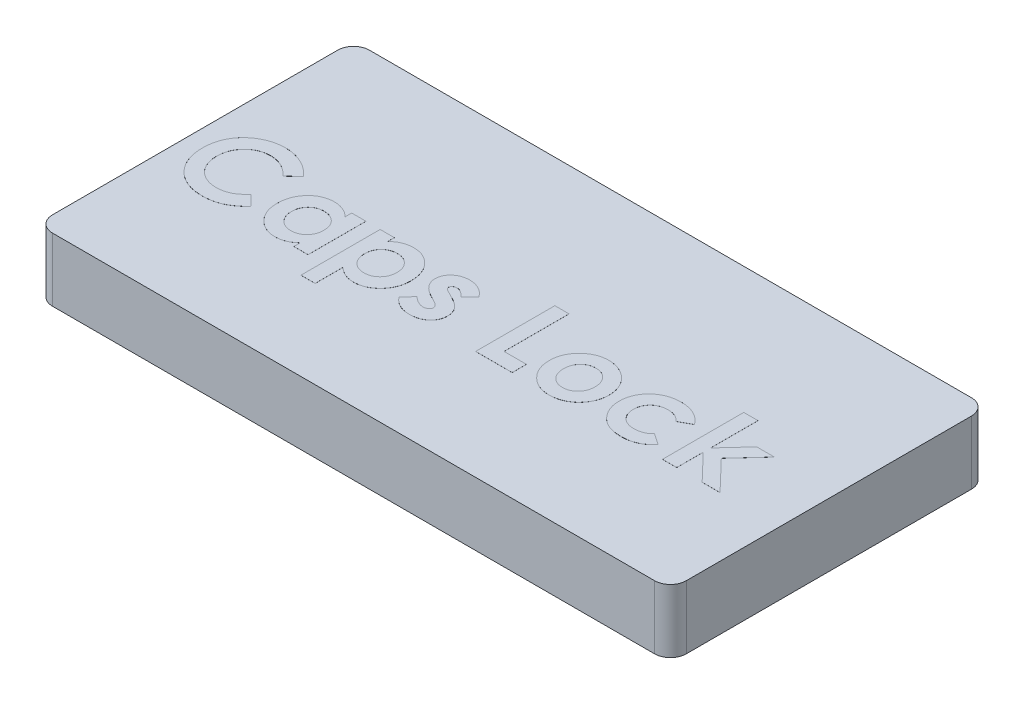
from build123d import *

# Parameters (mm, degrees)
SKETCH1_W           = 25.4
SKETCH1_H           = 12.7
BOSS_EXTRUDE1_DEPTH = 2.54
FILLET1_R           = 0.635
SHELL1_START        = 0.635
SHELL1_OUTLINE_W    = 1.905
SHELL1_OUTLINE_H    = 11.43
SHELL1_DEPTH        = 24.13
SKETCH2_R           = 2.54
BOSS_EXTRUDE2_DEPTH = 1.905
BOSS_EXTRUDE3_DEPTH = 0.00254


# Read off the part's stored shape, not the designer's step: Shell1
with BuildPart() as part:
    # Sketch1 → Boss-Extrude1 (new body)
    with BuildSketch(Plane(origin=(0, 0, 0), x_dir=(1, 0, 0), z_dir=(0, 1, 0))):
        with Locations((12.7, 6.35)):
            Rectangle(SKETCH1_W, SKETCH1_H)
    extrude(amount=BOSS_EXTRUDE1_DEPTH)

    # Fillet1
    fillet1_edges = [part.edges().sort_by_distance(p)[0] for p in [
        (0, 1.27, -12.7),
        (25.4, 1.27, -12.7),
        (25.4, 1.27, 0),
        (0, 1.27, 0),
    ]]
    fillet(fillet1_edges, radius=FILLET1_R)

    # Shell1 outline → Shell1 (cut)
    with BuildSketch(Plane.YZ.offset(SHELL1_START)):
        with Locations((0.9525, -6.35)):
            Rectangle(SHELL1_OUTLINE_W, SHELL1_OUTLINE_H)
    extrude(amount=SHELL1_DEPTH, mode=Mode.SUBTRACT)

    # Sketch2 → Boss-Extrude2 (add)
    with BuildSketch(Plane(origin=(0, 1.905, 0), x_dir=(-1, 0, 0), z_dir=(0, -1, 0))):
        with Locations(Location((-12.7, 6.35, 0), (0, 0, 270))):
            Circle(SKETCH2_R)
    extrude(amount=BOSS_EXTRUDE2_DEPTH)

    # Sketch3 → Boss-Extrude3 (add)
    # profile 1 of 8: a face of its own
    with BuildSketch(Plane(origin=(0, 2.54, 0), x_dir=(1, 0, 0), z_dir=(0, 1, 0))):
        with BuildLine():
            Line((3.698305128, 6.993008734), (3.280441546, 6.593589663))
            add(Edge.make_bspline(
                [(3.280441546, 6.593589663), (3.244994953, 6.6302415), (3.175756652, 6.70183402), (3.064187691, 6.796616208), (2.948160035, 6.875604336), (2.829930769, 6.942127635), (2.707373291, 6.992457252), (2.581904701, 7.029133291), (2.452723843, 7.051493286), (2.365299207, 7.054051666), (2.321326963, 7.055338462)],
                knots=[0, 0, 0, 0, 1.115251505, 2.178435587, 3.19620269, 4.182487026, 5.141301733, 6.088180966, 7.038406374, 8, 8, 8, 8], degree=3))
            add(Edge.make_bspline(
                [(2.321326963, 7.055338462), (2.284604796, 7.054321848), (2.212137645, 7.052315672), (2.105736877, 7.037608428), (2.003959044, 7.012598119), (1.906455743, 6.978129281), (1.813513883, 6.933528433), (1.7249386, 6.878830097), (1.640948271, 6.814528275), (1.562652361, 6.740955668), (1.491030014, 6.660572066), (1.42774711, 6.574802955), (1.374737527, 6.483844826), (1.331233425, 6.388618837), (1.29734541, 6.288684235), (1.273145111, 6.1841083), (1.259148304, 6.074766489), (1.257059187, 6.000436741), (1.255997436, 5.962660176)],
                knots=[0, 0, 0, 0, 1.035432265, 2.043311493, 3.022114605, 3.98653278, 4.95457646, 5.923598177, 6.917315552, 7.932509744, 8.948865224, 9.949768934, 10.933144597, 11.912367597, 12.897413939, 13.903909035, 14.934704909, 16, 16, 16, 16], degree=3))
            add(Edge.make_bspline(
                [(1.255997436, 5.962660176), (1.25630342, 5.93614594), (1.256906522, 5.883885836), (1.263508537, 5.806578637), (1.274139337, 5.731572378), (1.289524739, 5.658980674), (1.308764335, 5.588740615), (1.331336762, 5.520246244), (1.359653539, 5.454443999), (1.39108559, 5.390569629), (1.427640702, 5.330366028), (1.467053857, 5.272956898), (1.509790988, 5.218623652), (1.556128908, 5.167588408), (1.606719763, 5.120648731), (1.660255968, 5.076393089), (1.717640605, 5.035929351), (1.777681648, 4.998242035), (1.840897778, 4.965502743), (1.905573793, 4.93584727), (1.972690313, 4.911762616), (2.041430153, 4.892348188), (2.111547662, 4.875839117), (2.183728654, 4.865673974), (2.25734741, 4.857976031), (2.307101332, 4.857500728), (2.332139263, 4.857261538)],
                knots=[0, 0, 0, 0, 1.103660481, 2.175337485, 3.227646561, 4.255952547, 5.262355991, 6.258840057, 7.255597736, 8.242457506, 9.22035537, 10.185017736, 11.140346927, 12.096287581, 13.051739095, 14.01125915, 14.986044842, 15.97314143, 16.960198552, 17.947847494, 18.933482797, 19.925264591, 20.920966487, 21.929612487, 22.958107872, 24, 24, 24, 24], degree=3))
            add(Edge.make_bspline(
                [(2.332139263, 4.857261538), (2.374607897, 4.858489957), (2.458047719, 4.860903479), (2.580507656, 4.879776883), (2.697199775, 4.910822564), (2.79043622, 4.94748571), (2.863484512, 4.983691042), (2.919095097, 5.017179191), (2.976600776, 5.054639363), (3.035046429, 5.097485345), (3.095089454, 5.145202968), (3.155669952, 5.198837337), (3.218338796, 5.256622348), (3.259392535, 5.297864647), (3.280441546, 5.319010337)],
                knots=[0, 0, 0, 0, 1.404581149, 2.759636711, 4.088442092, 5.392261763, 6.066678138, 6.783632037, 7.538459478, 8.336747902, 9.180226004, 10.074962426, 11.012997595, 12, 12, 12, 12], degree=3))
            Line((3.280441546, 5.319010337), (3.685584776, 4.893514543))
            add(Edge.make_bspline(
                [(3.685584776, 4.893514543), (3.657105387, 4.866018588), (3.601519712, 4.812352363), (3.517670264, 4.736151332), (3.433926343, 4.667676235), (3.352311029, 4.604441725), (3.271487378, 4.548289979), (3.19146396, 4.499164915), (3.113146676, 4.45582409), (3.034909243, 4.418998427), (2.956264826, 4.387729614), (2.875348963, 4.360809219), (2.791914287, 4.338035533), (2.705451216, 4.319660159), (2.616766225, 4.30492559), (2.525029341, 4.294979841), (2.430822221, 4.288293645), (2.366920072, 4.287692834), (2.334683333, 4.287389744)],
                knots=[0, 0, 0, 0, 1.244526981, 2.429050516, 3.560637417, 4.644440555, 5.67424972, 6.652764056, 7.595344123, 8.486817594, 9.369275933, 10.254498637, 11.166417451, 12.086725134, 13.032340136, 13.991389299, 14.986715468, 16, 16, 16, 16], degree=3))
            add(Edge.make_bspline(
                [(2.334683333, 4.287389744), (2.275468437, 4.288899249), (2.159601344, 4.291852933), (1.98980114, 4.313737726), (1.828495505, 4.350427196), (1.675292012, 4.402316227), (1.530239375, 4.468602032), (1.393374704, 4.549865316), (1.264918595, 4.645890176), (1.145908719, 4.755551107), (1.038258622, 4.876662399), (0.943108403, 5.006702701), (0.864400139, 5.146311114), (0.799046971, 5.293425175), (0.747941653, 5.448716222), (0.711972173, 5.612352234), (0.689790057, 5.78417521), (0.687363302, 5.901534263), (0.686125641, 5.961388141)],
                knots=[0, 0, 0, 0, 1.078019885, 2.10938526, 3.111377082, 4.085535484, 5.04941344, 6.010039228, 6.978205633, 7.964457913, 8.951525778, 9.924444315, 10.892603023, 11.863865945, 12.85144698, 13.863884204, 14.910567087, 16, 16, 16, 16], degree=3))
            add(Edge.make_bspline(
                [(0.686125641, 5.961388141), (0.686648616, 6.00042433), (0.687685026, 6.077784515), (0.698577786, 6.191742336), (0.713762928, 6.302830827), (0.737852774, 6.409896523), (0.766890707, 6.514381794), (0.803003193, 6.615151009), (0.846132553, 6.712493788), (0.894888628, 6.806573089), (0.950045888, 6.896772592), (1.011662603, 6.98231734), (1.078152517, 7.063867724), (1.151113276, 7.140341827), (1.229484664, 7.212411105), (1.313620519, 7.279685002), (1.403014805, 7.343128301), (1.49790948, 7.401104953), (1.596460994, 7.453547916), (1.697426351, 7.49980485), (1.800557492, 7.538464994), (1.905418369, 7.570532158), (2.012452019, 7.594468028), (2.120894461, 7.61258671), (2.231668412, 7.622715169), (2.306043523, 7.624373262), (2.34358758, 7.625210256)],
                knots=[0, 0, 0, 0, 1.071919942, 2.124283339, 3.142214191, 4.149696895, 5.136002878, 6.119640489, 7.086990633, 8.058538607, 9.028339693, 9.988281803, 10.952401235, 11.916291999, 12.888973767, 13.874849856, 14.873389453, 15.898127285, 16.927174885, 17.938320013, 18.946391617, 19.950418109, 20.947802303, 21.956882652, 22.968648068, 24, 24, 24, 24], degree=3))
            add(Edge.make_bspline(
                [(2.34358758, 7.625210256), (2.37561651, 7.62473047), (2.439341359, 7.623775887), (2.534238353, 7.615818393), (2.628376405, 7.603321229), (2.721418472, 7.584465671), (2.814030086, 7.56208174), (2.904994226, 7.53277307), (2.995745903, 7.500103034), (3.084861809, 7.461052678), (3.172466337, 7.418425686), (3.256507215, 7.370063816), (3.33839548, 7.318943202), (3.416316537, 7.262038304), (3.491730016, 7.201413168), (3.564241572, 7.136784943), (3.633214876, 7.067076087), (3.676498691, 7.017822665), (3.698305128, 6.993008734)],
                knots=[0, 0, 0, 0, 0.996412454, 1.982464992, 2.961075852, 3.949442424, 4.934965278, 5.923860011, 6.921385422, 7.934793307, 8.949617135, 9.951082467, 10.950285876, 11.951772932, 12.951063433, 13.960125323, 14.972308753, 16, 16, 16, 16], degree=3))
        make_face()
    # profile 2 of 8: a face of its own
    with BuildSketch(Plane(origin=(0, 2.54, 0), x_dir=(1, 0, 0), z_dir=(0, 1, 0))):
        with BuildLine():
            Line((5.937087179, 6.688992308), (6.506958974, 6.688992308))
            Line((6.506958974, 6.688992308), (6.506958974, 4.3688))
            Line((6.506958974, 4.3688), (5.937087179, 4.3688))
            Line((5.937087179, 4.3688), (5.937087179, 4.621935016))
            add(Edge.make_bspline(
                [(5.937087179, 4.621935016), (5.908850242, 4.597295124), (5.854047923, 4.549473959), (5.7676972, 4.487424782), (5.681094151, 4.43624223), (5.593822645, 4.395478118), (5.504541356, 4.365378018), (5.412607494, 4.343584842), (5.316697114, 4.330732873), (5.251498559, 4.328983365), (5.21838726, 4.328094872)],
                knots=[0, 0, 0, 0, 1.129196829, 2.191548051, 3.199897424, 4.157751732, 5.089409408, 6.034969131, 7.002052659, 8, 8, 8, 8], degree=3))
            add(Edge.make_bspline(
                [(5.21838726, 4.328094872), (5.181218355, 4.328931056), (5.107770492, 4.330583403), (4.999993907, 4.347977023), (4.895924899, 4.374601836), (4.795647944, 4.412279273), (4.699345487, 4.461101846), (4.60628052, 4.519795704), (4.518048462, 4.590421354), (4.433914811, 4.669923004), (4.356882545, 4.757375384), (4.289540211, 4.851564668), (4.232775628, 4.951154988), (4.186271443, 5.055816157), (4.149689896, 5.165471359), (4.123612487, 5.280468388), (4.108226786, 5.400848314), (4.10632247, 5.482846405), (4.10535641, 5.52444403)],
                knots=[0, 0, 0, 0, 0.980476535, 1.937477201, 2.874147792, 3.812856188, 4.758993464, 5.720109578, 6.712210464, 7.737600662, 8.772720504, 9.783789959, 10.789002326, 11.793715968, 12.802552247, 13.835794126, 14.902098527, 16, 16, 16, 16], degree=3))
            add(Edge.make_bspline(
                [(4.10535641, 5.52444403), (4.106370293, 5.567518426), (4.108359138, 5.652013653), (4.122907417, 5.776006381), (4.148503599, 5.893854751), (4.183405834, 6.005722001), (4.228301498, 6.111627458), (4.282981417, 6.211744627), (4.34818946, 6.305811819), (4.42333017, 6.392227944), (4.504463681, 6.471432497), (4.591262195, 6.540386342), (4.682368373, 6.598965841), (4.777879031, 6.646789445), (4.877780529, 6.683745106), (4.981678458, 6.710762712), (5.090034052, 6.726974224), (5.163846761, 6.72878216), (5.201214784, 6.729697436)],
                knots=[0, 0, 0, 0, 1.136281865, 2.228943489, 3.287578264, 4.313574083, 5.316051562, 6.317280042, 7.318008486, 8.329309503, 9.333984563, 10.305318864, 11.248632312, 12.186624717, 13.117503092, 14.05354244, 15.014596925, 16, 16, 16, 16], degree=3))
            add(Edge.make_bspline(
                [(5.201214784, 6.729697436), (5.235829681, 6.728978304), (5.304320085, 6.727555402), (5.40499111, 6.712105404), (5.502627486, 6.688738379), (5.596696599, 6.655444575), (5.687970037, 6.613404374), (5.774877838, 6.560724869), (5.85932119, 6.499620156), (5.910844911, 6.45189608), (5.937087179, 6.427589063)],
                knots=[0, 0, 0, 0, 1.017011718, 2.012299608, 2.98747302, 3.965332399, 4.941441765, 5.936729654, 6.94912688, 8, 8, 8, 8], degree=3))
            Line((5.937087179, 6.427589063), (5.937087179, 6.688992308))
        make_face()
        with BuildLine():
            add(Edge.make_bspline(
                [(5.320786098, 6.200530769), (5.298078387, 6.199834018), (5.253572755, 6.198468432), (5.188121134, 6.190254334), (5.125569019, 6.175780729), (5.066362526, 6.154399085), (5.009619262, 6.128353127), (4.956200882, 6.095730993), (4.905666508, 6.057172324), (4.858313337, 6.013610625), (4.815143945, 5.965728353), (4.77792941, 5.91347842), (4.746303067, 5.858268665), (4.719555401, 5.79993309), (4.70041014, 5.737781407), (4.685247101, 5.672622718), (4.677378466, 5.603924712), (4.67595213, 5.557109147), (4.675228205, 5.533348277)],
                knots=[0, 0, 0, 0, 1.04836806, 2.054732945, 3.03993516, 4.00574415, 4.955904794, 5.917688631, 6.888591924, 7.88601754, 8.884115178, 9.859153345, 10.841239365, 11.818093293, 12.814750328, 13.83810466, 14.90274714, 16, 16, 16, 16], degree=3))
            add(Edge.make_bspline(
                [(4.675228205, 5.533348277), (4.675941072, 5.509371883), (4.677345769, 5.462126676), (4.68537433, 5.392849178), (4.699991739, 5.326738674), (4.721317989, 5.264329623), (4.747362287, 5.204779922), (4.779064054, 5.148364396), (4.818004123, 5.096080544), (4.861211357, 5.046691154), (4.909535971, 5.002588346), (4.960356289, 4.963429101), (5.014366478, 4.930664586), (5.070980564, 4.904184097), (5.130007982, 4.882604725), (5.192188758, 4.868313023), (5.256913752, 4.859176608), (5.301038489, 4.857904303), (5.323330168, 4.857261538)],
                knots=[0, 0, 0, 0, 1.099136573, 2.165835871, 3.191374663, 4.196217796, 5.183857741, 6.167377911, 7.154730987, 8.166690795, 9.170734848, 10.148332609, 11.103258353, 12.059567475, 13.009337315, 13.978056681, 14.978520572, 16, 16, 16, 16], degree=3))
            add(Edge.make_bspline(
                [(5.323330168, 4.857261538), (5.346460837, 4.857962196), (5.391809522, 4.859335864), (5.458328954, 4.867474999), (5.521721368, 4.882001674), (5.581723019, 4.903505733), (5.639250375, 4.929364732), (5.693784304, 4.961349405), (5.744733029, 4.999819592), (5.792354582, 5.04377509), (5.835990556, 5.092048349), (5.873719739, 5.144983457), (5.906583238, 5.200887404), (5.932428868, 5.261081961), (5.952953922, 5.324514007), (5.967680175, 5.391577213), (5.975690403, 5.462343882), (5.977082814, 5.510644891), (5.977792308, 5.53525633)],
                knots=[0, 0, 0, 0, 1.050008698, 2.058587853, 3.036635738, 3.995319155, 4.947022481, 5.895997462, 6.858296291, 7.838991643, 8.833936038, 9.806048392, 10.784806122, 11.771666913, 12.772873988, 13.80724452, 14.882696879, 16, 16, 16, 16], degree=3))
            add(Edge.make_bspline(
                [(5.977792308, 5.53525633), (5.977091631, 5.559444464), (5.975723005, 5.606690916), (5.967645629, 5.675980011), (5.952814828, 5.741726402), (5.932712213, 5.80405094), (5.906406782, 5.862811121), (5.873518418, 5.917355434), (5.836203102, 5.969573636), (5.792084015, 6.016542768), (5.744720438, 6.060179994), (5.693022429, 6.097486815), (5.638618757, 6.129638869), (5.581175164, 6.156036944), (5.520159748, 6.175387735), (5.456659, 6.190370343), (5.389682177, 6.198463502), (5.344126226, 6.199830435), (5.320786098, 6.200530769)],
                knots=[0, 0, 0, 0, 1.106611376, 2.161533483, 3.185006901, 4.184773755, 5.152708835, 6.122342771, 7.094156588, 8.082475533, 9.064254463, 10.03606828, 10.992420271, 11.951521816, 12.920622147, 13.915721683, 14.932141191, 16, 16, 16, 16], degree=3))
        make_face(mode=Mode.SUBTRACT)
    # profile 3 of 8: a face of its own
    with BuildSketch(Plane(origin=(0, 2.54, 0), x_dir=(1, 0, 0), z_dir=(0, 1, 0))):
        with BuildLine():
            Line((7.646702564, 6.688992308), (7.646702564, 6.427589063))
            add(Edge.make_bspline(
                [(7.646702564, 6.427589063), (7.673159208, 6.451896948), (7.725117325, 6.499635127), (7.81018682, 6.560754246), (7.897608567, 6.613246085), (7.988988849, 6.65546635), (8.083073592, 6.688732576), (8.180705852, 6.712106942), (8.281167831, 6.727522964), (8.349444804, 6.728968889), (8.383846995, 6.729697436)],
                knots=[0, 0, 0, 0, 1.054376801, 2.070687235, 3.070225973, 4.045259405, 5.022040922, 5.996139433, 6.99033025, 8, 8, 8, 8], degree=3))
            add(Edge.make_bspline(
                [(8.383846995, 6.729697436), (8.421218566, 6.728802293), (8.494828434, 6.727039151), (8.603131349, 6.710577688), (8.706920138, 6.683968866), (8.806590574, 6.646815699), (8.901611624, 6.598578516), (8.993050918, 6.540823597), (9.079331477, 6.471167658), (9.160495246, 6.392270627), (9.235573753, 6.305793621), (9.300878229, 6.211774761), (9.355274322, 6.111451517), (9.401377684, 6.006009919), (9.435025769, 5.893701252), (9.460958905, 5.776032063), (9.475410304, 5.652006845), (9.477412595, 5.567516127), (9.478433333, 5.52444403)],
                knots=[0, 0, 0, 0, 0.985987466, 1.942075377, 2.884088208, 3.810275091, 4.743821533, 5.692411115, 6.659945104, 7.665215984, 8.677116751, 9.678438675, 10.680260931, 11.685531812, 12.710472044, 13.769734641, 14.863044265, 16, 16, 16, 16], degree=3))
            add(Edge.make_bspline(
                [(9.478433333, 5.52444403), (9.477467273, 5.482846406), (9.475562955, 5.400848317), (9.460177266, 5.280468375), (9.434099813, 5.165471405), (9.39751843, 5.055815991), (9.351013636, 4.951155604), (9.294251326, 4.851562361), (9.226900393, 4.757384137), (9.149900895, 4.66988961), (9.065767755, 4.590656812), (8.978107053, 4.519569238), (8.885172877, 4.461318547), (8.789288373, 4.412121375), (8.688942997, 4.37450125), (8.584822153, 4.348144124), (8.477090741, 4.33052275), (8.403846503, 4.328912225), (8.366674519, 4.328094872)],
                knots=[0, 0, 0, 0, 1.098553145, 2.165490463, 3.199345634, 4.208780719, 5.21409072, 6.219899742, 7.23156933, 8.267303578, 9.293302409, 10.281606823, 11.243293419, 12.184993323, 13.124258899, 14.066907486, 15.018941492, 16, 16, 16, 16], degree=3))
            add(Edge.make_bspline(
                [(8.366674519, 4.328094872), (8.33354998, 4.328898208), (8.268296631, 4.330480731), (8.1723431, 4.344590932), (8.079650899, 4.365666778), (7.990097415, 4.397388275), (7.902675908, 4.439482434), (7.81589748, 4.491903099), (7.729561467, 4.555943865), (7.674914784, 4.605338498), (7.646702564, 4.630839263)],
                knots=[0, 0, 0, 0, 0.990856396, 1.951927477, 2.896945079, 3.83213376, 4.788585491, 5.796263726, 6.862286081, 8, 8, 8, 8], degree=3))
            Line((7.646702564, 4.630839263), (7.646702564, 3.513992308))
            Line((7.646702564, 3.513992308), (7.076830769, 3.513992308))
            Line((7.076830769, 3.513992308), (7.076830769, 6.688992308))
            Line((7.076830769, 6.688992308), (7.646702564, 6.688992308))
        make_face()
        with BuildLine():
            add(Edge.make_bspline(
                [(8.260459575, 6.200530769), (8.237332478, 6.199819595), (8.191990794, 6.198425307), (8.125420945, 6.190434649), (8.06234484, 6.175400168), (8.001803459, 6.15591394), (7.944563431, 6.129610594), (7.890156466, 6.097725531), (7.839048565, 6.059705027), (7.790974481, 6.017054648), (7.747776094, 5.969072891), (7.709398074, 5.917801896), (7.677558394, 5.862574016), (7.651016551, 5.804089535), (7.63099189, 5.741715658), (7.616139393, 5.675982999), (7.608068003, 5.606690117), (7.606698541, 5.559444193), (7.605997436, 5.53525633)],
                knots=[0, 0, 0, 0, 1.060469436, 2.079096586, 3.066888298, 4.028858836, 4.99004353, 5.948472697, 6.914558426, 7.905691313, 8.889602648, 9.869280844, 10.836099585, 11.806137001, 12.808075328, 13.83377171, 14.890985086, 16, 16, 16, 16], degree=3))
            add(Edge.make_bspline(
                [(7.605997436, 5.53525633), (7.606707363, 5.510645159), (7.608100625, 5.462344677), (7.61610473, 5.391574218), (7.630852978, 5.32452463), (7.651299396, 5.261043895), (7.677389594, 5.201123778), (7.70919155, 5.144542145), (7.747992012, 5.092539519), (7.790715849, 5.04329269), (7.839087187, 5.00007164), (7.889964846, 4.961308303), (7.944550213, 4.929375712), (8.002063793, 4.903502765), (8.06206918, 4.882002488), (8.125460566, 4.867474773), (8.191980281, 4.859335924), (8.237328927, 4.857962216), (8.260459575, 4.857261538)],
                knots=[0, 0, 0, 0, 1.117193555, 2.192540452, 3.22680955, 4.227918444, 5.21468246, 6.188555072, 7.166222992, 8.154674427, 9.142376254, 10.104580718, 11.053462639, 12.005072638, 12.963662044, 13.941614018, 14.950094269, 16, 16, 16, 16], degree=3))
            add(Edge.make_bspline(
                [(8.260459575, 4.857261538), (8.282748854, 4.857912446), (8.32686884, 4.859200871), (8.391423854, 4.868191043), (8.453477305, 4.882881878), (8.512543233, 4.903821632), (8.568981196, 4.93108517), (8.623304987, 4.962988023), (8.673639147, 5.002848256), (8.721958367, 5.046658054), (8.76519116, 5.096062907), (8.803976172, 5.148549056), (8.836556734, 5.204584951), (8.862424932, 5.264356415), (8.88381091, 5.326731289), (8.898411791, 5.392851251), (8.906444928, 5.462126131), (8.907848992, 5.509371699), (8.908561538, 5.533348277)],
                knots=[0, 0, 0, 0, 1.021711385, 2.02240246, 2.981887075, 3.941027022, 4.888772411, 5.852236371, 6.822344989, 7.82661704, 8.838806642, 9.826383926, 10.814965113, 11.80282933, 12.807900643, 13.833672313, 14.900613836, 16, 16, 16, 16], degree=3))
            add(Edge.make_bspline(
                [(8.908561538, 5.533348277), (8.907837613, 5.557109147), (8.906411278, 5.603924712), (8.898542642, 5.672622718), (8.883379605, 5.737781408), (8.86423434, 5.799933083), (8.837486689, 5.858268689), (8.805860288, 5.913478327), (8.768645968, 5.965728699), (8.725475754, 6.0136093), (8.678125638, 6.057177207), (8.627580195, 6.09571338), (8.574037923, 6.128518643), (8.516769692, 6.154389308), (8.457126943, 6.175675291), (8.39419821, 6.190337357), (8.328303416, 6.198452165), (8.283377923, 6.199828595), (8.260459575, 6.200530769)],
                knots=[0, 0, 0, 0, 1.094680664, 2.156827393, 3.177782763, 4.17210342, 5.146667393, 6.126451192, 7.099203661, 8.094961544, 9.09004898, 10.058676268, 11.018205477, 11.974998356, 12.947750825, 13.930643515, 14.944335875, 16, 16, 16, 16], degree=3))
        make_face(mode=Mode.SUBTRACT)
    # profile 4 of 8: a face of its own
    with BuildSketch(Plane(origin=(0, 2.54, 0), x_dir=(1, 0, 0), z_dir=(0, 1, 0))):
        with BuildLine():
            Line((11.391574359, 6.330914383), (11.043036699, 5.9563))
            add(Edge.make_bspline(
                [(11.043036699, 5.9563), (11.025632544, 5.975558641), (10.992344988, 6.012393127), (10.941384957, 6.062606763), (10.89118382, 6.104419888), (10.842677072, 6.139544656), (10.794874031, 6.166481155), (10.748172049, 6.185861362), (10.702548717, 6.198164206), (10.672307644, 6.199756762), (10.657610016, 6.200530769)],
                knots=[0, 0, 0, 0, 1.327646587, 2.539285, 3.655602211, 4.666613517, 5.598770349, 6.454635452, 7.248928967, 8, 8, 8, 8], degree=3))
            add(Edge.make_bspline(
                [(10.657610016, 6.200530769), (10.642737492, 6.200077506), (10.614261236, 6.199209647), (10.574074858, 6.191765596), (10.538768436, 6.178878571), (10.50889295, 6.161312355), (10.484890455, 6.139672582), (10.46808519, 6.114917191), (10.456800299, 6.087816135), (10.455845671, 6.068565207), (10.45535641, 6.058698838)],
                knots=[0, 0, 0, 0, 1.295068245, 2.479652818, 3.543291146, 4.55379989, 5.481948265, 6.332409746, 7.145336708, 8, 8, 8, 8], degree=3))
            add(Edge.make_bspline(
                [(10.45535641, 6.058698838), (10.45701407, 6.043747025), (10.460453521, 6.012723748), (10.484077778, 5.976741376), (10.515334377, 5.950197917), (10.551364198, 5.925497704), (10.600157903, 5.897880222), (10.637174047, 5.878969724), (10.657610016, 5.868529567)],
                knots=[0, 0, 0, 0, 0.916701701, 1.902049539, 2.5493345, 3.440293453, 4.586830489, 6, 6, 6, 6], degree=3))
            Line((10.657610016, 5.868529567), (10.863679728, 5.764222676))
            add(Edge.make_bspline(
                [(10.863679728, 5.764222676), (10.889895735, 5.750911039), (10.940759714, 5.725083963), (11.012269703, 5.683408507), (11.07831747, 5.643013663), (11.137578114, 5.601614403), (11.190414349, 5.559929972), (11.236450883, 5.517548166), (11.276804332, 5.475812568), (11.321804093, 5.419856541), (11.366817359, 5.345327666), (11.404344442, 5.248406337), (11.428275007, 5.144624904), (11.430922649, 5.072793817), (11.432279487, 5.035982492)],
                knots=[0, 0, 0, 0, 1.076693506, 2.088987655, 3.030641824, 3.911722491, 4.735175175, 5.493635918, 6.202154166, 6.859459289, 8.120623445, 9.372284821, 10.653373066, 12, 12, 12, 12], degree=3))
            add(Edge.make_bspline(
                [(11.432279487, 5.035982492), (11.431461983, 5.011148007), (11.429861911, 4.962540329), (11.419746593, 4.890994462), (11.401576862, 4.822964935), (11.377665523, 4.757391305), (11.345457667, 4.695459341), (11.306355751, 4.63686882), (11.26097721, 4.58085048), (11.208122396, 4.529320598), (11.150220831, 4.481295312), (11.08585347, 4.440902598), (11.017866359, 4.405388119), (10.944463384, 4.377654473), (10.866674482, 4.355169854), (10.78383284, 4.339588577), (10.696219558, 4.32978288), (10.63622463, 4.328667095), (10.605456571, 4.328094872)],
                knots=[0, 0, 0, 0, 0.976600749, 1.911466839, 2.833459288, 3.740827163, 4.650527853, 5.570709661, 6.506801416, 7.479409329, 8.468875524, 9.458587492, 10.461481786, 11.480119772, 12.538142914, 13.641687514, 14.790552763, 16, 16, 16, 16], degree=3))
            add(Edge.make_bspline(
                [(10.605456571, 4.328094872), (10.564691534, 4.329393012), (10.484673355, 4.331941146), (10.367812599, 4.349691086), (10.25746502, 4.380416532), (10.153539835, 4.423458951), (10.055400514, 4.478306792), (9.964448599, 4.546360957), (9.879107354, 4.625848346), (9.829454931, 4.686811473), (9.804074359, 4.717973678)],
                knots=[0, 0, 0, 0, 1.056901255, 2.07460411, 3.05625841, 4.019970729, 4.984811261, 5.963335951, 6.958928997, 8, 8, 8, 8], degree=3))
            Line((9.804074359, 4.717973678), (10.149431931, 5.101492308))
            add(Edge.make_bspline(
                [(10.149431931, 5.101492308), (10.166258918, 5.083744163), (10.199665991, 5.048508292), (10.255976816, 5.002045032), (10.315557657, 4.959697189), (10.379071792, 4.924138818), (10.44259876, 4.895427034), (10.503547644, 4.873889179), (10.560769796, 4.860354091), (10.597974164, 4.858256934), (10.615632853, 4.857261538)],
                knots=[0, 0, 0, 0, 1.087861918, 2.159761696, 3.243809206, 4.338405912, 5.394481878, 6.343674753, 7.213841449, 8, 8, 8, 8], degree=3))
            add(Edge.make_bspline(
                [(10.615632853, 4.857261538), (10.633281983, 4.857772669), (10.667208482, 4.858755203), (10.715426823, 4.868975487), (10.75816496, 4.886157293), (10.794408491, 4.909980303), (10.824554891, 4.93732548), (10.845796321, 4.968403435), (10.85984228, 5.001357895), (10.861549401, 5.0243984), (10.862407692, 5.035982492)],
                knots=[0, 0, 0, 0, 1.255011871, 2.412479185, 3.488767498, 4.514443302, 5.48617286, 6.365347346, 7.178144445, 8, 8, 8, 8], degree=3))
            add(Edge.make_bspline(
                [(10.862407692, 5.035982492), (10.861641842, 5.046891353), (10.860069405, 5.069289349), (10.847620365, 5.102350392), (10.828075127, 5.13508613), (10.800966949, 5.167588859), (10.765935122, 5.199594859), (10.723105015, 5.230847771), (10.673464721, 5.263014977), (10.636797574, 5.282214491), (10.617540905, 5.292297596)],
                knots=[0, 0, 0, 0, 0.704666567, 1.446816302, 2.258757648, 3.165368109, 4.175243826, 5.322435858, 6.59381024, 8, 8, 8, 8], degree=3))
            Line((10.617540905, 5.292297596), (10.42864367, 5.38770024))
            add(Edge.make_bspline(
                [(10.42864367, 5.38770024), (10.385794236, 5.410677821), (10.303539389, 5.454786161), (10.192361584, 5.530422589), (10.098265623, 5.610939073), (10.021174824, 5.69590305), (9.959748723, 5.78507609), (9.916899897, 5.879593541), (9.889944071, 5.978559356), (9.886978499, 6.046233254), (9.885484615, 6.080323437)],
                knots=[0, 0, 0, 0, 1.255999728, 2.41104856, 3.467751088, 4.449286722, 5.368722015, 6.253902015, 7.120417131, 8, 8, 8, 8], degree=3))
            add(Edge.make_bspline(
                [(9.885484615, 6.080323437), (9.886002682, 6.102417491), (9.88701973, 6.145791706), (9.897846819, 6.209489748), (9.914204228, 6.27071976), (9.937286293, 6.329578979), (9.966854016, 6.386125811), (10.003079607, 6.440109305), (10.046405013, 6.491431319), (10.095443207, 6.539926533), (10.149852622, 6.584093212), (10.208078699, 6.623235217), (10.269949215, 6.656576928), (10.335971934, 6.683159311), (10.405307671, 6.704317234), (10.478414115, 6.71869888), (10.554979362, 6.727845658), (10.60733778, 6.729071431), (10.634077364, 6.729697436)],
                knots=[0, 0, 0, 0, 0.959035663, 1.882742823, 2.798841253, 3.708806893, 4.623422363, 5.566085165, 6.527241613, 7.536786942, 8.55815439, 9.567237405, 10.580975912, 11.605536372, 12.654523293, 13.725718749, 14.838518481, 16, 16, 16, 16], degree=3))
            add(Edge.make_bspline(
                [(10.634077364, 6.729697436), (10.671045011, 6.728480308), (10.744419271, 6.726064525), (10.852631873, 6.706515992), (10.957154022, 6.67365942), (11.057692693, 6.628388559), (11.152954646, 6.571495952), (11.240845024, 6.502409112), (11.321958638, 6.422829271), (11.368138686, 6.361856923), (11.391574359, 6.330914383)],
                knots=[0, 0, 0, 0, 0.996590028, 1.978055413, 2.954661574, 3.945146934, 4.945404762, 5.939399542, 6.954276554, 8, 8, 8, 8], degree=3))
        make_face()
    # profile 5 of 8: a face of its own
    with BuildSketch(Plane(origin=(0, 2.54, 0), x_dir=(1, 0, 0), z_dir=(0, 1, 0))):
        Polygon((13.223305128, 7.5438), (13.793176923, 7.5438), (13.793176923, 4.938671795), (14.688689744, 4.938671795), (14.688689744, 4.3688), (13.223305128, 4.3688), align=None)
    # profile 6 of 8: a face of its own
    with BuildSketch(Plane(origin=(0, 2.54, 0), x_dir=(1, 0, 0), z_dir=(0, 1, 0))):
        with BuildLine():
            add(Edge.make_bspline(
                [(16.201139663, 6.729697436), (16.228082102, 6.729217977), (16.281440338, 6.72826843), (16.360910765, 6.720364324), (16.438991865, 6.70746845), (16.516132439, 6.690770543), (16.591616165, 6.667374278), (16.665838944, 6.639314075), (16.739464423, 6.607097682), (16.810665233, 6.568748905), (16.879955746, 6.527156158), (16.945647276, 6.481275947), (17.0071943, 6.431468643), (17.06573934, 6.378889069), (17.118554104, 6.321248081), (17.169013738, 6.261323064), (17.21439203, 6.196967113), (17.256405792, 6.129748435), (17.293810342, 6.060055742), (17.326289315, 5.98837384), (17.354478009, 5.915693784), (17.376549192, 5.84113028), (17.394822097, 5.765666546), (17.406353599, 5.688377832), (17.414551698, 5.610058087), (17.415470964, 5.557326789), (17.415933333, 5.530804207)],
                knots=[0, 0, 0, 0, 1.022364134, 2.024744242, 3.027414945, 4.024939316, 5.017584196, 6.023349371, 7.035562955, 8.064994934, 9.090267829, 10.101425541, 11.102933353, 12.093946398, 13.084502048, 14.067315274, 15.065326281, 16.070028806, 17.074376865, 18.064572984, 19.055292013, 20.030201733, 21.013838017, 21.999348303, 22.993720005, 24, 24, 24, 24], degree=3))
            add(Edge.make_bspline(
                [(17.415933333, 5.530804207), (17.415445379, 5.504074416), (17.414475216, 5.450929534), (17.406650196, 5.371873095), (17.39370496, 5.294220928), (17.376942966, 5.217515572), (17.353634256, 5.142738544), (17.326400517, 5.068787602), (17.292970031, 4.996670725), (17.256010165, 4.925601186), (17.213726272, 4.857670345), (17.16838726, 4.792669703), (17.118138976, 4.732304533), (17.065747009, 4.674702744), (17.00872629, 4.62181217), (16.947986975, 4.572774009), (16.884054898, 4.526988747), (16.816470321, 4.485530594), (16.746098889, 4.449102794), (16.674127402, 4.416260159), (16.600135012, 4.38891632), (16.52427485, 4.366618172), (16.446500909, 4.349353275), (16.366984894, 4.337625025), (16.285898053, 4.329468162), (16.231264933, 4.328555582), (16.203683734, 4.328094872)],
                knots=[0, 0, 0, 0, 1.012026251, 2.012137606, 3.004615893, 3.992048833, 4.982446996, 5.968083444, 6.973977695, 7.990229942, 8.999482246, 10.001782172, 10.988562221, 11.971415814, 12.948383116, 13.930088534, 14.925840678, 15.924049238, 16.929462851, 17.924729459, 18.917889337, 19.913673841, 20.916777188, 21.931792057, 22.95587778, 24, 24, 24, 24], degree=3))
            add(Edge.make_bspline(
                [(16.203683734, 4.328094872), (16.163354397, 4.329278617), (16.083864659, 4.331611798), (15.966795069, 4.347593474), (15.854329838, 4.375102129), (15.746285706, 4.413448588), (15.64252232, 4.462588146), (15.543945245, 4.523405811), (15.449573907, 4.594704257), (15.361042889, 4.675880864), (15.279936483, 4.764938954), (15.20908028, 4.860007921), (15.148917629, 4.959662843), (15.099502659, 5.064017359), (15.061364379, 5.173214568), (15.033822034, 5.286928009), (15.017820818, 5.405477312), (15.01550737, 5.486023129), (15.014330769, 5.526988101)],
                knots=[0, 0, 0, 0, 1.029999031, 2.030143771, 3.011211297, 3.982305373, 4.953580601, 5.938004764, 6.935448627, 7.970290061, 9.001484052, 10.007591832, 10.993831261, 11.969999897, 12.951306496, 13.942897864, 14.953773953, 16, 16, 16, 16], degree=3))
            add(Edge.make_bspline(
                [(15.014330769, 5.526988101), (15.015548402, 5.570729711), (15.017941635, 5.65670297), (15.036944958, 5.782655753), (15.067291214, 5.903249574), (15.110851354, 6.018147093), (15.166495602, 6.127560224), (15.234424617, 6.231258201), (15.31497411, 6.329264515), (15.376658892, 6.388542093), (15.408025681, 6.418684816)],
                knots=[0, 0, 0, 0, 1.043912699, 2.05178951, 3.033892, 4.007821512, 4.978932272, 5.95884105, 6.962068106, 8, 8, 8, 8], degree=3))
            add(Edge.make_bspline(
                [(15.408025681, 6.418684816), (15.436807846, 6.443669743), (15.493589098, 6.492959831), (15.585839945, 6.555476228), (15.680294402, 6.609471322), (15.778084548, 6.653865332), (15.879482995, 6.687337699), (15.983970134, 6.711702588), (16.091524239, 6.726668216), (16.164415505, 6.728682565), (16.201139663, 6.729697436)],
                knots=[0, 0, 0, 0, 1.048115528, 2.067714963, 3.060638214, 4.039924844, 5.017819947, 5.994373833, 6.98952318, 8, 8, 8, 8], degree=3))
        make_face()
        with BuildLine():
            add(Edge.make_bspline(
                [(16.213860016, 6.200530769), (16.191796144, 6.199797439), (16.148363174, 6.198353871), (16.084428702, 6.190606627), (16.023958805, 6.174727985), (15.965752438, 6.154534697), (15.910839277, 6.127529021), (15.857715447, 6.095926156), (15.809143271, 6.056379059), (15.762772184, 6.012998787), (15.720677573, 5.96482616), (15.684808968, 5.912342118), (15.652759575, 5.857554591), (15.628458145, 5.79845774), (15.608346388, 5.736666854), (15.594734993, 5.671183578), (15.585262412, 5.602739398), (15.584559207, 5.555854665), (15.584202564, 5.532076242)],
                knots=[0, 0, 0, 0, 1.030650113, 2.02884584, 2.99876339, 3.944280128, 4.900564847, 5.851248946, 6.823638398, 7.81794922, 8.81432732, 9.802856497, 10.78262424, 11.771747962, 12.779760563, 13.812642396, 14.89064281, 16, 16, 16, 16], degree=3))
            add(Edge.make_bspline(
                [(15.584202564, 5.532076242), (15.584619885, 5.507459272), (15.585435458, 5.459350131), (15.593880887, 5.389104316), (15.607807678, 5.322441502), (15.627593284, 5.259464671), (15.652477024, 5.199721782), (15.683006487, 5.143548032), (15.719503878, 5.091281174), (15.760883061, 5.042985569), (15.806191499, 4.999147114), (15.855836944, 4.961526592), (15.90774043, 4.928839352), (15.963098096, 4.902586453), (16.021123705, 4.882317085), (16.08198951, 4.867393431), (16.146015362, 4.85935329), (16.189670874, 4.857968377), (16.211951963, 4.857261538)],
                knots=[0, 0, 0, 0, 1.141730614, 2.231293227, 3.276944405, 4.297399982, 5.28939179, 6.275415646, 7.257752684, 8.24146775, 9.222424823, 10.176631434, 11.126518621, 12.063689483, 13.012557477, 13.974037417, 14.965980454, 16, 16, 16, 16], degree=3))
            add(Edge.make_bspline(
                [(16.211951963, 4.857261538), (16.234244196, 4.857888472), (16.277949914, 4.859117625), (16.342050952, 4.868322044), (16.403227583, 4.882807984), (16.461748776, 4.903251803), (16.517141381, 4.930066632), (16.569617447, 4.962910252), (16.619638612, 5.001054041), (16.665555094, 5.045719644), (16.708059103, 5.094165866), (16.745332577, 5.146708638), (16.776479697, 5.202882401), (16.802025913, 5.262333712), (16.821850305, 5.324980853), (16.835546536, 5.391056677), (16.845024181, 5.460356409), (16.845711482, 5.507874384), (16.846061538, 5.532076242)],
                knots=[0, 0, 0, 0, 1.031504075, 2.022346795, 2.991027682, 3.937587355, 4.885570121, 5.833146507, 6.798790848, 7.791235734, 8.792807298, 9.778388351, 10.766749885, 11.760164525, 12.768777521, 13.802286646, 14.880660483, 16, 16, 16, 16], degree=3))
            add(Edge.make_bspline(
                [(16.846061538, 5.532076242), (16.845638909, 5.556269642), (16.844809573, 5.60374494), (16.836363542, 5.673138399), (16.822573424, 5.739000647), (16.802532628, 5.801050458), (16.777796793, 5.859995721), (16.747246228, 5.915534719), (16.710568844, 5.967393906), (16.668988505, 6.015316136), (16.623000865, 6.058539438), (16.574217385, 6.097084131), (16.521522538, 6.128963553), (16.465904909, 6.155243576), (16.407216527, 6.175462303), (16.34552328, 6.190470533), (16.280636097, 6.198396267), (16.23635134, 6.199811832), (16.213860016, 6.200530769)],
                knots=[0, 0, 0, 0, 1.123894411, 2.205445421, 3.243160173, 4.246488011, 5.231014757, 6.210004299, 7.185865357, 8.177612767, 9.153374344, 10.115157457, 11.061423229, 12.009021698, 12.96873347, 13.94135618, 14.954456845, 16, 16, 16, 16], degree=3))
        make_face(mode=Mode.SUBTRACT)
    # profile 7 of 8: a face of its own
    with BuildSketch(Plane(origin=(0, 2.54, 0), x_dir=(1, 0, 0), z_dir=(0, 1, 0))):
        with BuildLine():
            Line((20.143176923, 6.215795192), (19.671251843, 5.9563))
            add(Edge.make_bspline(
                [(19.671251843, 5.9563), (19.649620517, 5.977961867), (19.608039671, 6.019601421), (19.541361442, 6.07231049), (19.475874666, 6.115952133), (19.408879593, 6.148157424), (19.339777368, 6.172411095), (19.266075556, 6.188474834), (19.186913928, 6.199052235), (19.13215774, 6.200027763), (19.103924119, 6.200530769)],
                knots=[0, 0, 0, 0, 1.150764855, 2.212059359, 3.192108068, 4.105322427, 5.000809612, 5.941206042, 6.938435785, 8, 8, 8, 8], degree=3))
            add(Edge.make_bspline(
                [(19.103924119, 6.200530769), (19.078031939, 6.199905378), (19.027363115, 6.198681538), (18.953327922, 6.1895403), (18.882965058, 6.175182899), (18.816400827, 6.154177972), (18.753753788, 6.12642932), (18.694505877, 6.093592964), (18.639232826, 6.054386361), (18.588715937, 6.009366822), (18.543115565, 5.959801308), (18.502437707, 5.906937557), (18.469112935, 5.849991348), (18.440301602, 5.790301123), (18.419119159, 5.726745767), (18.403621569, 5.659901977), (18.394788086, 5.589766794), (18.393508271, 5.541852482), (18.39285641, 5.517447837)],
                knots=[0, 0, 0, 0, 1.121765476, 2.195200973, 3.227634963, 4.230038321, 5.213228299, 6.192116585, 7.160777141, 8.14345191, 9.118668839, 10.075979138, 11.027630062, 11.972829041, 12.943187208, 13.923755399, 14.94248691, 16, 16, 16, 16], degree=3))
            add(Edge.make_bspline(
                [(18.39285641, 5.517447837), (18.393545157, 5.493680072), (18.394889984, 5.447271829), (18.403152146, 5.37908706), (18.417495571, 5.31417807), (18.439001659, 5.252888013), (18.464779109, 5.194651883), (18.497150868, 5.139932841), (18.535218273, 5.088491945), (18.579181734, 5.040776291), (18.627882092, 4.997861914), (18.680384897, 4.959964076), (18.736533501, 4.927833721), (18.79698198, 4.902618613), (18.860744783, 4.882073576), (18.928247719, 4.867444704), (18.999418955, 4.859324669), (19.047934584, 4.857959879), (19.072759255, 4.857261538)],
                knots=[0, 0, 0, 0, 1.070556293, 2.090336998, 3.088792742, 4.058148387, 5.011235098, 5.952916408, 6.915475435, 7.888633318, 8.869583867, 9.83422472, 10.800707077, 11.776204622, 12.778807041, 13.814557445, 14.881744048, 16, 16, 16, 16], degree=3))
            add(Edge.make_bspline(
                [(19.072759255, 4.857261538), (19.103324374, 4.857960958), (19.162983045, 4.859326123), (19.24970944, 4.870905012), (19.331317791, 4.890052424), (19.407816752, 4.916553962), (19.4790993, 4.951205217), (19.544982279, 4.99352914), (19.606142966, 5.043213514), (19.641808509, 5.08194857), (19.659803526, 5.101492308)],
                knots=[0, 0, 0, 0, 1.116373375, 2.178998604, 3.189797796, 4.174590301, 5.13072713, 6.078291395, 7.030403691, 8, 8, 8, 8], degree=3))
            Line((19.659803526, 5.101492308), (20.102471795, 4.797475881))
            add(Edge.make_bspline(
                [(20.102471795, 4.797475881), (20.071788157, 4.759961254), (20.01123633, 4.685928988), (19.905590183, 4.590504101), (19.79188302, 4.508512919), (19.667827943, 4.443068597), (19.535231604, 4.391016005), (19.393057891, 4.35421999), (19.241547281, 4.332559744), (19.137492459, 4.329606952), (19.084207572, 4.328094872)],
                knots=[0, 0, 0, 0, 0.997876357, 1.969233105, 2.924898516, 3.881013542, 4.852507933, 5.855329832, 6.901747111, 8, 8, 8, 8], degree=3))
            add(Edge.make_bspline(
                [(19.084207572, 4.328094872), (19.036247869, 4.329203558), (18.94257728, 4.331368944), (18.806054724, 4.347951716), (18.677648172, 4.375883137), (18.55709347, 4.414674142), (18.44450053, 4.464923017), (18.3402345, 4.527250398), (18.24359211, 4.599922564), (18.156317174, 4.683282815), (18.078447905, 4.774021348), (18.010467754, 4.86958345), (17.951675409, 4.968256927), (17.905552872, 5.071684161), (17.867858047, 5.178253062), (17.842400146, 5.28923751), (17.825609092, 5.403723312), (17.823866482, 5.481346076), (17.822984615, 5.520627925)],
                knots=[0, 0, 0, 0, 1.183377041, 2.311265848, 3.387807024, 4.421911742, 5.431260577, 6.423665966, 7.413571885, 8.409103097, 9.395976332, 10.359992013, 11.300391101, 12.225292883, 13.150239058, 14.085544813, 15.031169026, 16, 16, 16, 16], degree=3))
            add(Edge.make_bspline(
                [(17.822984615, 5.520627925), (17.823457038, 5.547995922), (17.824392761, 5.602203508), (17.832380881, 5.68270782), (17.844807712, 5.761846005), (17.863483771, 5.839062556), (17.886452026, 5.914732099), (17.914373051, 5.988839423), (17.948348153, 6.061002122), (17.986247483, 6.131834055), (18.029442164, 6.199465364), (18.076566665, 6.2638662), (18.127554592, 6.324642136), (18.183004923, 6.381226759), (18.242531025, 6.434024953), (18.305267542, 6.484107896), (18.373244596, 6.528892695), (18.444099044, 6.570998679), (18.518441222, 6.608481114), (18.59541667, 6.640833398), (18.674430539, 6.668321328), (18.755672221, 6.690422179), (18.838793011, 6.708637332), (18.924532537, 6.720197417), (19.012181448, 6.728322752), (19.071467924, 6.729236445), (19.101380048, 6.729697436)],
                knots=[0, 0, 0, 0, 1.00272354, 1.986087015, 2.96193297, 3.936200312, 4.894695956, 5.858592327, 6.835334787, 7.815655071, 8.800643866, 9.773423113, 10.738352213, 11.705312252, 12.673769326, 13.65298065, 14.64420052, 15.654211674, 16.672258995, 17.692438602, 18.712115155, 19.735602823, 20.776372304, 21.827874031, 22.90408564, 24, 24, 24, 24], degree=3))
            add(Edge.make_bspline(
                [(19.101380048, 6.729697436), (19.129164574, 6.729383308), (19.183961533, 6.728763782), (19.264884255, 6.722285774), (19.343599569, 6.711282593), (19.420241436, 6.696725848), (19.495042613, 6.678687505), (19.567000569, 6.654642999), (19.637099088, 6.62735339), (19.727386721, 6.58614893), (19.833819316, 6.524644605), (19.95065379, 6.436433843), (20.054825867, 6.333240118), (20.113570039, 6.255151578), (20.143176923, 6.215795192)],
                knots=[0, 0, 0, 0, 0.826738014, 1.630502179, 2.413926014, 3.191023582, 3.95155221, 4.701751672, 5.446919844, 6.189438973, 7.653650558, 9.094719814, 10.535747635, 12, 12, 12, 12], degree=3))
        make_face()
    # profile 8 of 8: a face of its own
    with BuildSketch(Plane(origin=(0, 2.54, 0), x_dir=(1, 0, 0), z_dir=(0, 1, 0))):
        Polygon((20.713048718, 7.625210256), (21.282920513, 7.625210256), (21.282920513, 5.726061619), (22.169529087, 6.688992308), (22.873600601, 6.688992308), (21.855336378, 5.582957652), (23.019248638, 4.3688), (22.301820753, 4.3688), (21.282920513, 5.431585457), (21.282920513, 4.3688), (20.713048718, 4.3688), align=None)
    extrude(amount=BOSS_EXTRUDE3_DEPTH)


solid = part.part
